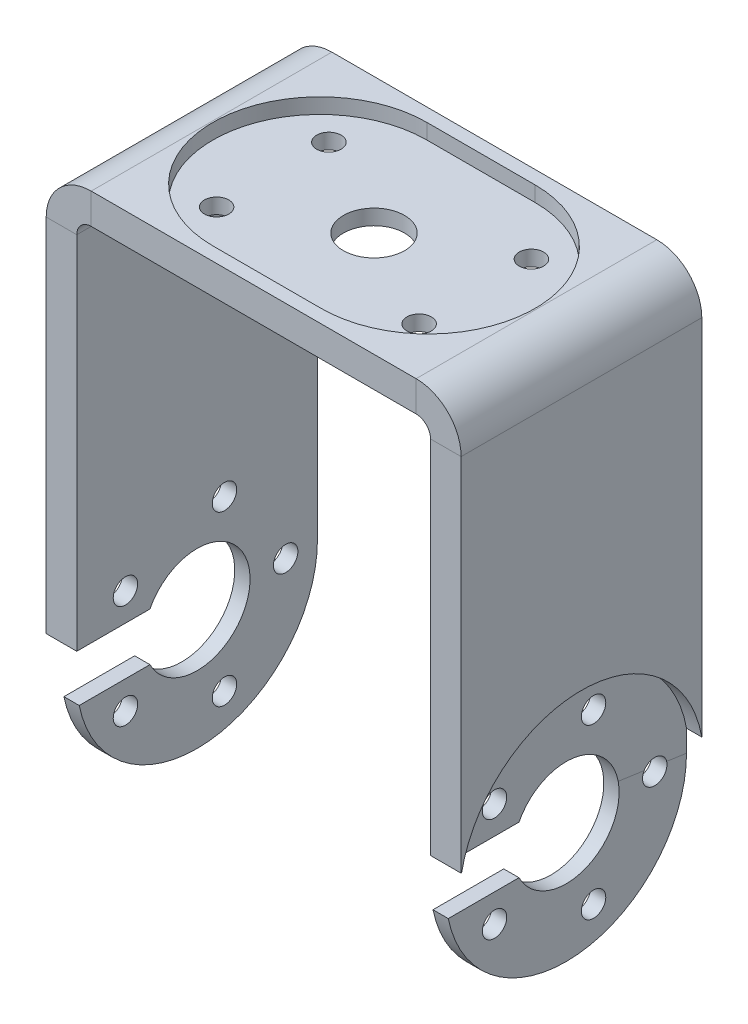
from build123d import *

# Parameters (mm, degrees)
SKETCH1_W                 = 67.5
SKETCH1_H                 = 50
BOSS_EXTRUDE1_DEPTH       = 6.35
EDGE_FLANGE1_DEPTH        = 50
EDGE_FLANGE1_START        = -6.35
EDGE_FLANGE1_FLAT_DEPTH   = 6.35
EDGE_FLANGE1_BEND_DEPTH   = 50
EDGE_FLANGE1_FLAT_2_DEPTH = 6.35
CUT_EXTRUDE1_DEPTH        = 141.387472732
CUT_EXTRUDE3_DEPTH        = 3.175
SKETCH16_R                = 2.54
CUT_EXTRUDE4_DEPTH        = 122.784135358
SKETCH17_R                = 6.35
CUT_EXTRUDE5_DEPTH        = 122.784135358
SKETCH18_R                = 25.4
CUT_EXTRUDE6_DEPTH        = 3.175
CUT_EXTRUDE7_START        = -3.175
SKETCH19_R                = 25.4
CUT_EXTRUDE7_DEPTH        = 3.175
SKETCH20_R                = 2.54
CUT_EXTRUDE8_DEPTH        = 139.460655513


# Sheet-metal steps are written as plain solids
with BuildPart() as part:
    # Sketch1 → Boss-Extrude1 (new body)
    with BuildSketch(Plane(origin=(0, 0, 0), x_dir=(1, 0, 0), z_dir=(0, 1, 0))):
        Rectangle(SKETCH1_W, SKETCH1_H)
    extrude(amount=BOSS_EXTRUDE1_DEPTH)

    # Edge-Flange1 bend section (across the edge) → Edge-Flange1 (add)
    with BuildSketch(Plane(origin=(36.75, 0, -25), x_dir=(-1, 0, 0), z_dir=(0, 0, 1))):
        with BuildLine():
            Line((-6.35, 3), (0, 3))
            ThreePointArc((0, 3), (0.878679656, 0.878679656), (3, 0))
            Line((3, 0), (3, -6.35))
            ThreePointArc((3, -6.35), (-3.611448404, -3.611448404), (-6.35, 3))
        make_face()
    extrude(amount=EDGE_FLANGE1_DEPTH)

    # Edge-Flange1 profile (on flange) → Edge-Flange1 flat (add)
    with BuildSketch(Plane(origin=(36.75, 0, 0), x_dir=(0, 0, -1), z_dir=(-1, 0, 0)).offset(EDGE_FLANGE1_START)):
        with BuildLine():
            ThreePointArc((25, 82.95), (0, 107.95), (-25, 82.95))
            Line((-25, 82.95), (-25, 3))
            Line((-25, 3), (25, 3))
            Line((25, 3), (25, 82.95))
        make_face()
    extrude(amount=EDGE_FLANGE1_FLAT_DEPTH)

    # Edge-Flange1 bend section 2 (across the edge) → Edge-Flange1 bend (add)
    with BuildSketch(Plane(origin=(-36.75, 0, 25), x_dir=(1, 0, 0), z_dir=(0, 0, -1))):
        with BuildLine():
            Line((-6.35, 3), (0, 3))
            ThreePointArc((0, 3), (0.878679656, 0.878679656), (3, 0))
            Line((3, 0), (3, -6.35))
            ThreePointArc((3, -6.35), (-3.611448404, -3.611448404), (-6.35, 3))
        make_face()
    extrude(amount=EDGE_FLANGE1_BEND_DEPTH)

    # Edge-Flange1 profile 2 (on flange) → Edge-Flange1 flat 2 (add)
    with BuildSketch(Plane(origin=(-36.75, 0, 0), x_dir=(0, 0, 1), z_dir=(1, 0, 0)).offset(EDGE_FLANGE1_START)):
        with BuildLine():
            ThreePointArc((25, 82.95), (0, 107.95), (-25, 82.95))
            Line((-25, 82.95), (-25, 3))
            Line((-25, 3), (25, 3))
            Line((25, 3), (25, 82.95))
        make_face()
    extrude(amount=EDGE_FLANGE1_FLAT_2_DEPTH)

    # Sketch13 → Cut-Extrude1 (cut, through all)
    with BuildSketch(Plane.ZY.offset(43.1)):
        with BuildLine():
            Line((9.797958971, -87.95), (25, -87.95))
            Line((25, -87.95), (25, -77.95))
            Line((25, -77.95), (9.797958971, -77.95))
            ThreePointArc((9.797958971, -77.95), (-11, -82.95), (9.797958971, -87.95))
        make_face()
    extrude(amount=-CUT_EXTRUDE1_DEPTH, mode=Mode.SUBTRACT)

    # Sketch15 → Cut-Extrude3 (cut)
    with BuildSketch(Plane(origin=(0, 6.35, 0), x_dir=(1, 0, 0), z_dir=(0, 1, 0))):
        with BuildLine():
            Line((-11.25, 22.225), (11.25, 22.225))
            ThreePointArc((11.25, 22.225), (33.475, 0), (11.25, -22.225))
            Line((11.25, -22.225), (-11.25, -22.225))
            ThreePointArc((-11.25, -22.225), (-33.475, 0), (-11.25, 22.225))
        make_face()
    extrude(amount=-CUT_EXTRUDE3_DEPTH, mode=Mode.SUBTRACT)

    # Sketch16 → Cut-Extrude4 (cut, through all)
    with BuildSketch(Plane(origin=(0, 3.175, 0), x_dir=(1, 0, 0), z_dir=(0, 1, 0))):
        with Locations(Location((-21.036441357, -11.663026646, 0), (0, 0, 270))):
            Circle(SKETCH16_R)
        with Locations(Location((-21.036441357, 11.663026646, 0), (0, 0, 270))):
            Circle(SKETCH16_R)
        with Locations(Location((21.036441357, 11.663026646, 0), (0, 0, 270))):
            Circle(SKETCH16_R)
        with Locations(Location((21.036441357, -11.663026646, 0), (0, 0, 270))):
            Circle(SKETCH16_R)
    extrude(amount=-CUT_EXTRUDE4_DEPTH, mode=Mode.SUBTRACT)

    # Sketch17 → Cut-Extrude5 (cut, through all)
    with BuildSketch(Plane(origin=(0, 3.175, 0), x_dir=(1, 0, 0), z_dir=(0, 1, 0))):
        with Locations(Location((0, 0, 0), (0, 0, 270))):
            Circle(SKETCH17_R)
    extrude(amount=-CUT_EXTRUDE5_DEPTH, mode=Mode.SUBTRACT)

    # Sketch18 → Cut-Extrude6 (cut)
    with BuildSketch(Plane.ZY.offset(43.1)):
        with Locations((0, -82.95)):
            Circle(SKETCH18_R)
    extrude(amount=-CUT_EXTRUDE6_DEPTH, mode=Mode.SUBTRACT)

    # Sketch19 → Cut-Extrude7 (cut)
    with BuildSketch(Plane(origin=(43.1, 0, 0), x_dir=(0, 0, -1), z_dir=(1, 0, 0)).offset(CUT_EXTRUDE7_START)):
        with Locations((0, -82.95)):
            Circle(SKETCH19_R)
    extrude(amount=CUT_EXTRUDE7_DEPTH, mode=Mode.SUBTRACT)

    # Sketch20 → Cut-Extrude8 (cut, through all)
    with BuildSketch(Plane(origin=(39.925, 0, 0), x_dir=(0, 0, -1), z_dir=(1, 0, 0))):
        with Locations(Location((18.4, -82.95, 0), (0, 0, 150.134638176))):
            Circle(SKETCH20_R)
        with Locations(Location((5.685912696, -100.4494399, 0), (0, 0, 90))):
            Circle(SKETCH20_R)
        with Locations(Location((-14.885912696, -93.765248642, 0), (0, 0, 90))):
            Circle(SKETCH20_R)
        with Locations(Location((-14.885912696, -72.134751358, 0), (0, 0, 90))):
            Circle(SKETCH20_R)
        with Locations(Location((5.685912696, -65.4505601, 0), (0, 0, 90))):
            Circle(SKETCH20_R)
    extrude(amount=-CUT_EXTRUDE8_DEPTH, mode=Mode.SUBTRACT)


solid = part.part
